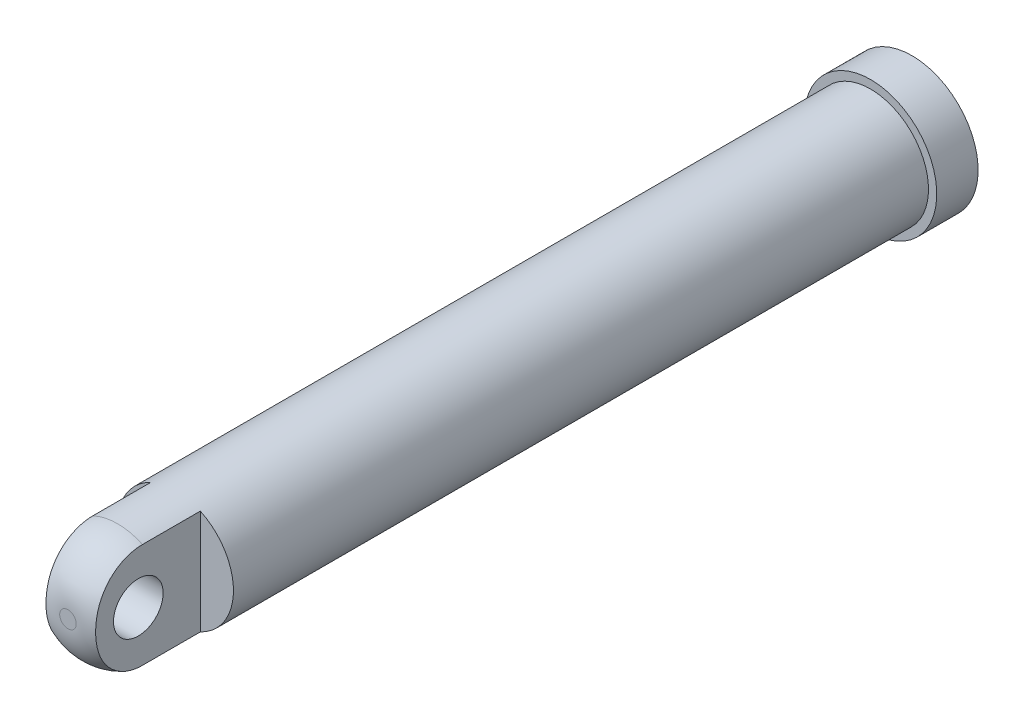
from build123d import *

# Parameters (mm, degrees)
SKETCH_1_R          = 70
EXTRUDE_2_DEPTH     = 1150
CUT_EXTRUDE_START   = -130
CUT_EXTRUDE_1_DEPTH = 130
SKETCH_3_R          = 30
CUT_EXTRUDE_2_DEPTH = 130
FILLET_1_R          = 60
SKETCH_4_R          = 50
CUT_EXTRUDE_3_DEPTH = 977
SKETCH_5_R          = 79.849645552
CUT_EXTRUDE_4_DEPTH = 100
SKETCH_6_R          = 77.974086693
CUT_EXTRUDE_5_DEPTH = 30
SKETCH_7_R          = 80
SKETCH_7_R_2        = 70
EXTRUDE_4_DEPTH     = 50
SCALE_1_SCALE       = 0.345


with BuildPart() as part:
    # 草图1 → 凸台-拉伸2 (new body)
    with BuildSketch(Plane.XY):
        Circle(SKETCH_1_R)
    extrude(amount=EXTRUDE_2_DEPTH)

    # 草图2 → 切除-拉伸1 (cut)
    with BuildSketch(Plane.XY.offset(1150).offset(CUT_EXTRUDE_START)):
        with BuildLine():
            ThreePointArc((70, 0), (59.160797831, 37.416573868), (30, 63.245553203))
            Line((30, 63.245553203), (30, -63.245553203))
            ThreePointArc((30, -63.245553203), (59.160797831, -37.416573868), (70, 0))
        make_face()
        with BuildLine():
            Line((-30, -63.245553203), (-30, 63.245553203))
            ThreePointArc((-30, 63.245553203), (-70, 0), (-30, -63.245553203))
        make_face()
    extrude(amount=CUT_EXTRUDE_1_DEPTH, mode=Mode.SUBTRACT)

    # 草图3 → 切除-拉伸2 (cut)
    with BuildSketch(Plane(origin=(30, 0, 0), x_dir=(0, 0, -1), z_dir=(1, 0, 0))):
        with Locations((-1095, 0)):
            Circle(SKETCH_3_R)
    extrude(amount=-CUT_EXTRUDE_2_DEPTH, mode=Mode.SUBTRACT)

    # 圆角1
    # the kernel refuses this fillet: 60 mm, written as the material it takes off along each edge
    with BuildSketch(Plane(origin=(0, 0, 1150), x_dir=(0.527411317590309, -0.8496100882626421, 0), z_dir=(-0.8496100882626421, -0.527411317590309, 0))) as fillet_1_piece_1:
        with BuildLine():
            CenterArc((70 - FILLET_1_R, -FILLET_1_R), FILLET_1_R, 0, 90)
            Line((70 - FILLET_1_R, 0), (70, 0))
            Line((70, 0), (70, -FILLET_1_R))
        make_face()
    revolve(axis=Axis((0, 0, 1150), (0, 0, 1)), revolution_arc=296.338571462, mode=Mode.SUBTRACT)
    with BuildSketch(Plane(origin=(0, 0, 1150), x_dir=(-0.527411317590308, 0.8496100882626425, 0), z_dir=(0.8496100882626425, 0.527411317590308, 0))) as fillet_1_piece_2:
        with BuildLine():
            CenterArc((70 - FILLET_1_R, -FILLET_1_R), FILLET_1_R, 0, 90)
            Line((70 - FILLET_1_R, 0), (70, 0))
            Line((70, 0), (70, -FILLET_1_R))
        make_face()
    revolve(axis=Axis((0, 0, 1150), (0, 0, 1)), revolution_arc=296.338571462, mode=Mode.SUBTRACT)

    # 草图4 → 切除-拉伸3 (cut)
    with BuildSketch(Plane(origin=(0, 0, 0), x_dir=(-1, 0, 0), z_dir=(0, 0, -1))):
        Circle(SKETCH_4_R)
    extrude(amount=-CUT_EXTRUDE_3_DEPTH, mode=Mode.SUBTRACT)

    # 草图5 → 切除-拉伸4 (cut)
    with BuildSketch(Plane(origin=(0, 0, 0), x_dir=(-1, 0, 0), z_dir=(0, 0, -1))):
        Circle(SKETCH_5_R)
    extrude(amount=-CUT_EXTRUDE_4_DEPTH, mode=Mode.SUBTRACT)

    # 草图6 → 切除-拉伸5 (cut)
    with BuildSketch(Plane(origin=(0, 0, 100), x_dir=(-1, 0, 0), z_dir=(0, 0, -1))):
        Circle(SKETCH_6_R)
    extrude(amount=-CUT_EXTRUDE_5_DEPTH, mode=Mode.SUBTRACT)

    # 草图7 → 凸台-拉伸4 (add)
    with BuildSketch(Plane(origin=(0, 0, 130), x_dir=(-1, 0, 0), z_dir=(0, 0, -1))):
        Circle(SKETCH_7_R)
        Circle(SKETCH_7_R_2, mode=Mode.SUBTRACT)
    extrude(amount=-EXTRUDE_4_DEPTH)


with BuildPart() as part_1:
    # 缩放比例1: scaled about (0, 0, 0)
    add(part.part.scale(SCALE_1_SCALE))


solid = part_1.part
